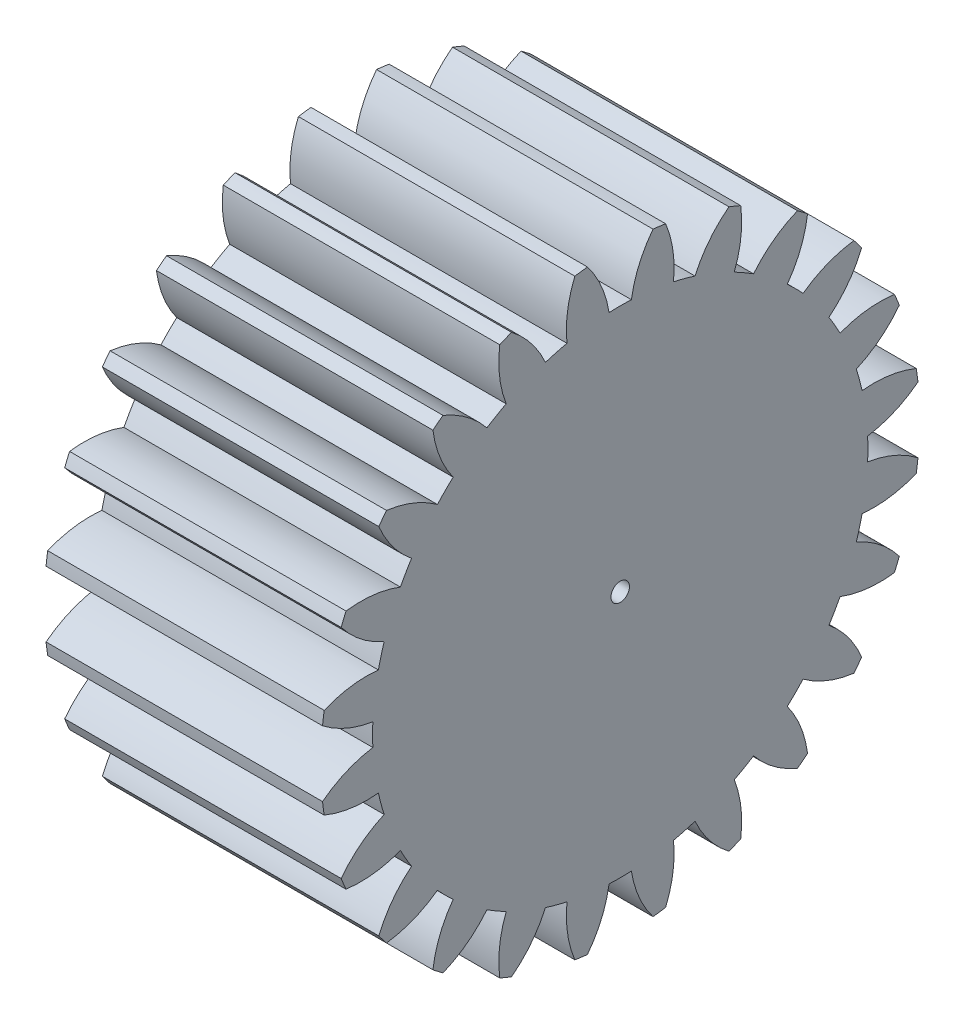
from build123d import *

# Parameters (mm, degrees)
BASPROSKE_W     = 12
BASPROSKE_H     = 13
TOOTHCUT_DEPTH  = 22.9544984
TEETHCUTS_COUNT = 24
TEETHCUTS_ANGLE = 345
BORSKE_R        = 0.4
BORE_DEPTH      = 50.00129032
SCALE1_SCALE    = 2


with BuildPart() as part:
    # BasProSke → Base-Revolve (revolve)
    with BuildSketch(Plane(origin=(0, 0, 0), x_dir=(1, 0, 0), z_dir=(0, 1, 0))):
        with Locations((6, 6.5)):
            Rectangle(BASPROSKE_W, BASPROSKE_H)
    revolve(axis=Axis((-10, 0, 0), (1, 0, 0)))

    # TooCutSke → ToothCut (cut, through all)
    with BuildSketch(Plane(origin=(0, 0, 0), x_dir=(0, 0, -1), z_dir=(1, 0, 0))):
        with BuildLine():
            ThreePointArc((0.483448384, 10.738122679), (0, 10.749), (-0.483448384, 10.738122679))
            ThreePointArc((-0.483448384, 10.738122679), (-0.98629758, 12.24466183), (-1.953240114, 13.504637888))
            ThreePointArc((-1.953240114, 13.504637888), (0, 13.64516), (1.953240114, 13.504637888))
            ThreePointArc((1.953240114, 13.504637888), (0.98629758, 12.24466183), (0.483448384, 10.738122679))
        make_face()
    toothcut = extrude(amount=TOOTHCUT_DEPTH, mode=Mode.SUBTRACT)

    # TeethCuts: ToothCut ×24 about axis
    teethcuts_axis = Axis((-10, 0, 0), (1, 0, 0))
    for i in range(1, TEETHCUTS_COUNT):
        add(toothcut.rotate(teethcuts_axis, i * TEETHCUTS_ANGLE / (TEETHCUTS_COUNT - 1)), mode=Mode.SUBTRACT)

    # BorSke → Bore (cut, symmetric)
    with BuildSketch(Plane(origin=(0, 0, 0), x_dir=(0, 0, -1), z_dir=(1, 0, 0))):
        Circle(BORSKE_R)
    extrude(amount=BORE_DEPTH, both=True, mode=Mode.SUBTRACT)


with BuildPart() as part_1:
    # Scale1: scaled about (6, 0, 0)
    add(part.part.scale(SCALE1_SCALE).moved(Location((-6, 0, 0))))


solid = part_1.part
